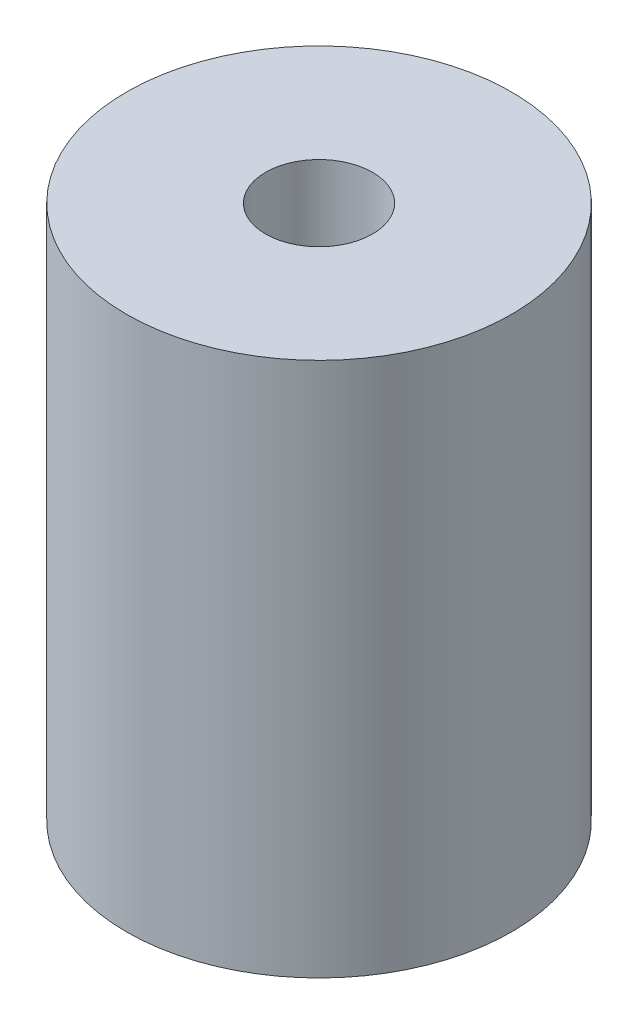
from build123d import *

# Parameters (mm, degrees)
SKETCH1_R           = 9
SKETCH1_R_2         = 2.5
BOSS_EXTRUDE1_DEPTH = 25
SKETCH2_R           = 4
CUT_EXTRUDE1_DEPTH  = 10


with BuildPart() as part:
    # Sketch1 → Boss-Extrude1 (new body)
    with BuildSketch(Plane(origin=(0, 0, 0), x_dir=(1, 0, 0), z_dir=(0, 1, 0))):
        Circle(SKETCH1_R)
        Circle(SKETCH1_R_2, mode=Mode.SUBTRACT)
    extrude(amount=BOSS_EXTRUDE1_DEPTH)

    # Sketch2 → Cut-Extrude1 (cut)
    with BuildSketch(Plane.XZ):
        Circle(SKETCH2_R)
    extrude(amount=-CUT_EXTRUDE1_DEPTH, mode=Mode.SUBTRACT)


solid = part.part
